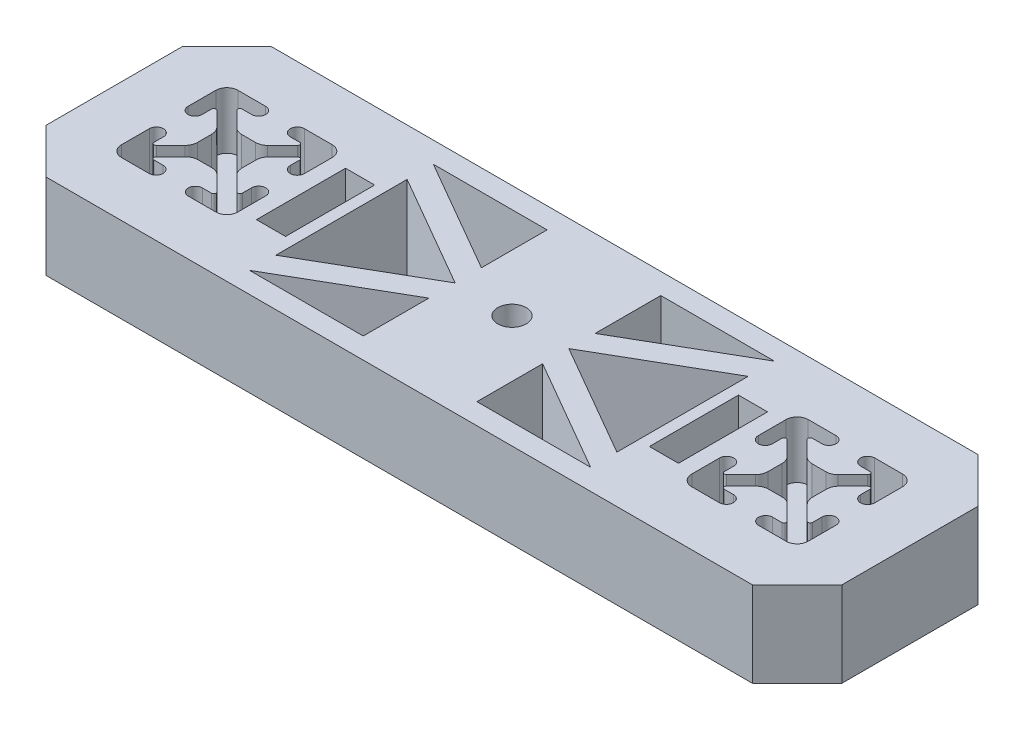
from build123d import *

# Parameters (mm, degrees)
SKETCH1_W           = 177.8
SKETCH1_H           = 50.4000008
BOSS_EXTRUDE1_DEPTH = 6.35
SKETCH2_W           = 177.8
SKETCH2_H           = 50.4000008
BOSS_EXTRUDE2_DEPTH = 12.7
SKETCH3_R           = 3.175
CUT_EXTRUDE1_DEPTH  = 186.784559586
CUT_EXTRUDE2_DEPTH  = 186.784559586
CHAMFER1_SIZE       = 10
SKETCH5_W           = 6.5
SKETCH5_H           = 19.9
CUT_EXTRUDE3_DEPTH  = 10.2
SKETCH6_W           = 6.5
SKETCH6_H           = 4.572
CUT_EXTRUDE4_DEPTH  = 186.086574555


with BuildPart() as part:
    # Sketch1 → Boss-Extrude1 (new body)
    with BuildSketch(Plane(origin=(0, 0, 0), x_dir=(1, 0, 0), z_dir=(0, 1, 0))):
        with Locations((88.9, 25.2000004)):
            Rectangle(SKETCH1_W, SKETCH1_H)
    extrude(amount=BOSS_EXTRUDE1_DEPTH)

    # Sketch2 → Boss-Extrude2 (add)
    with BuildSketch(Plane(origin=(0, 6.35, 0), x_dir=(1, 0, 0), z_dir=(0, 1, 0))):
        with Locations((88.9, 25.2000004)):
            Rectangle(SKETCH2_W, SKETCH2_H)
        with BuildLine():
            Line((38.207602115, 29.52001185), (38.207602115, 35.7371571))
            ThreePointArc((38.207602115, 35.7371571), (37.48390875, 37.484307436), (35.736758415, 38.2080008))
            Line((35.736758415, 38.2080008), (29.519613165, 38.2080008))
            ThreePointArc((29.519613165, 38.2080008), (27.941613165, 36.6300008), (29.519613165, 35.0520008))
            Line((29.519613165, 35.0520008), (31.618952135, 35.0520008))
            ThreePointArc((31.618952135, 35.0520008), (32.082805957, 34.741944038), (31.973665066, 34.194784253))
            Line((31.973665066, 34.194784253), (28.637609194, 30.863479703))
            ThreePointArc((28.637609194, 30.863479703), (27.774459736, 30.287408726), (26.756632806, 30.085138862))
            Line((26.756632806, 30.085138862), (23.642969309, 30.085138862))
            ThreePointArc((23.642969309, 30.085138862), (22.625142379, 30.287408726), (21.761992921, 30.863479703))
            Line((21.761992921, 30.863479703), (18.425937049, 34.194784253))
            ThreePointArc((18.425937049, 34.194784253), (18.316796158, 34.741944038), (18.78064998, 35.0520008))
            Line((18.78064998, 35.0520008), (20.87998895, 35.0520008))
            ThreePointArc((20.87998895, 35.0520008), (22.45798895, 36.6300008), (20.87998895, 38.2080008))
            Line((20.87998895, 38.2080008), (14.6628437, 38.2080008))
            ThreePointArc((14.6628437, 38.2080008), (12.915693364, 37.484307436), (12.192, 35.7371571))
            Line((12.192, 35.7371571), (12.192, 29.52001185))
            ThreePointArc((12.192, 29.52001185), (13.77, 27.94201185), (15.348, 29.52001185))
            Line((15.348, 29.52001185), (15.348, 31.596493464))
            ThreePointArc((15.348, 31.596493464), (15.657726258, 32.060210386), (16.204710632, 31.95171231))
            Line((16.204710632, 31.95171231), (19.406929995, 28.754053655))
            ThreePointArc((19.406929995, 28.754053655), (20.019806023, 27.837880259), (20.235040084, 26.756832148))
            Line((20.235040084, 26.756832148), (20.235040084, 23.643168652))
            ThreePointArc((20.235040084, 23.643168652), (20.019806023, 22.562120541), (19.406929995, 21.645947145))
            Line((19.406929995, 21.645947145), (16.204710632, 18.44828849))
            ThreePointArc((16.204710632, 18.44828849), (15.657726258, 18.339790414), (15.348, 18.803507336))
            Line((15.348, 18.803507336), (15.348, 20.87998895))
            ThreePointArc((15.348, 20.87998895), (13.77, 22.45798895), (12.192, 20.87998895))
            Line((12.192, 20.87998895), (12.192, 14.6628437))
            ThreePointArc((12.192, 14.6628437), (12.915693364, 12.915693364), (14.6628437, 12.192))
            Line((14.6628437, 12.192), (20.812064149, 12.192))
            ThreePointArc((20.812064149, 12.192), (22.390064149, 13.77), (20.812064149, 15.348))
            Line((20.812064149, 15.348), (18.78064998, 15.348))
            ThreePointArc((18.78064998, 15.348), (18.316796158, 15.658056762), (18.425937049, 16.205216547))
            Line((18.425937049, 16.205216547), (21.761992921, 19.536521097))
            ThreePointArc((21.761992921, 19.536521097), (22.625142379, 20.112592074), (23.642969309, 20.314861938))
            Line((23.642969309, 20.314861938), (26.756632806, 20.314861938))
            ThreePointArc((26.756632806, 20.314861938), (27.774459736, 20.112592074), (28.637609194, 19.536521097))
            Line((28.637609194, 19.536521097), (31.973665066, 16.205216547))
            ThreePointArc((31.973665066, 16.205216547), (32.082805957, 15.658056762), (31.618952135, 15.348))
            Line((31.618952135, 15.348), (29.587537966, 15.348))
            ThreePointArc((29.587537966, 15.348), (28.009537966, 13.77), (29.587537966, 12.192))
            Line((29.587537966, 12.192), (35.736758415, 12.192))
            ThreePointArc((35.736758415, 12.192), (37.48390875, 12.915693364), (38.207602115, 14.6628437))
            Line((38.207602115, 14.6628437), (38.207602115, 20.87998895))
            ThreePointArc((38.207602115, 20.87998895), (36.629602115, 22.45798895), (35.051602115, 20.87998895))
            Line((35.051602115, 20.87998895), (35.051602115, 18.803507336))
            ThreePointArc((35.051602115, 18.803507336), (34.741875857, 18.339790414), (34.194891482, 18.44828849))
            Line((34.194891482, 18.44828849), (30.99267212, 21.645947145))
            ThreePointArc((30.99267212, 21.645947145), (30.379796092, 22.562120541), (30.16456203, 23.643168652))
            Line((30.16456203, 23.643168652), (30.16456203, 26.756832148))
            ThreePointArc((30.16456203, 26.756832148), (30.379796092, 27.837880259), (30.99267212, 28.754053655))
            Line((30.99267212, 28.754053655), (34.194891482, 31.95171231))
            ThreePointArc((34.194891482, 31.95171231), (34.741875857, 32.060210386), (35.051602115, 31.596493464))
            Line((35.051602115, 31.596493464), (35.051602115, 29.52001185))
            ThreePointArc((35.051602115, 29.52001185), (36.629602115, 27.94201185), (38.207602115, 29.52001185))
        make_face(mode=Mode.SUBTRACT)
        with BuildLine():
            Line((142.748397885, 31.596493464), (142.748397885, 29.52001185))
            ThreePointArc((142.748397885, 29.52001185), (141.170397885, 27.94201185), (139.592397885, 29.52001185))
            Line((139.592397885, 29.52001185), (139.592397885, 35.7371571))
            ThreePointArc((139.592397885, 35.7371571), (140.31609125, 37.484307436), (142.063241585, 38.2080008))
            Line((142.063241585, 38.2080008), (148.280386835, 38.2080008))
            ThreePointArc((148.280386835, 38.2080008), (149.858386835, 36.6300008), (148.280386835, 35.0520008))
            Line((148.280386835, 35.0520008), (146.181047865, 35.0520008))
            ThreePointArc((146.181047865, 35.0520008), (145.717194043, 34.741944038), (145.826334934, 34.194784253))
            Line((145.826334934, 34.194784253), (149.162390806, 30.863479703))
            ThreePointArc((149.162390806, 30.863479703), (150.025540264, 30.287408726), (151.043367194, 30.085138862))
            Line((151.043367194, 30.085138862), (154.157030691, 30.085138862))
            ThreePointArc((154.157030691, 30.085138862), (155.174857621, 30.287408726), (156.038007079, 30.863479703))
            Line((156.038007079, 30.863479703), (159.374062951, 34.194784253))
            ThreePointArc((159.374062951, 34.194784253), (159.483203842, 34.741944038), (159.01935002, 35.0520008))
            Line((159.01935002, 35.0520008), (156.92001105, 35.0520008))
            ThreePointArc((156.92001105, 35.0520008), (155.34201105, 36.6300008), (156.92001105, 38.2080008))
            Line((156.92001105, 38.2080008), (163.1371563, 38.2080008))
            ThreePointArc((163.1371563, 38.2080008), (164.884306636, 37.484307436), (165.608, 35.7371571))
            Line((165.608, 35.7371571), (165.608, 29.52001185))
            ThreePointArc((165.608, 29.52001185), (164.03, 27.94201185), (162.452, 29.52001185))
            Line((162.452, 29.52001185), (162.452, 31.596493464))
            ThreePointArc((162.452, 31.596493464), (162.142273742, 32.060210386), (161.595289368, 31.95171231))
            Line((161.595289368, 31.95171231), (158.393070005, 28.754053655))
            ThreePointArc((158.393070005, 28.754053655), (157.780193977, 27.837880259), (157.564959916, 26.756832148))
            Line((157.564959916, 26.756832148), (157.564959916, 23.643168652))
            ThreePointArc((157.564959916, 23.643168652), (157.780193977, 22.562120541), (158.393070005, 21.645947145))
            Line((158.393070005, 21.645947145), (161.595289368, 18.44828849))
            ThreePointArc((161.595289368, 18.44828849), (162.142273742, 18.339790414), (162.452, 18.803507336))
            Line((162.452, 18.803507336), (162.452, 20.87998895))
            ThreePointArc((162.452, 20.87998895), (164.03, 22.45798895), (165.608, 20.87998895))
            Line((165.608, 20.87998895), (165.608, 14.6628437))
            ThreePointArc((165.608, 14.6628437), (164.884306636, 12.915693364), (163.1371563, 12.192))
            Line((163.1371563, 12.192), (156.987935851, 12.192))
            ThreePointArc((156.987935851, 12.192), (155.409935851, 13.77), (156.987935851, 15.348))
            Line((156.987935851, 15.348), (159.01935002, 15.348))
            ThreePointArc((159.01935002, 15.348), (159.483203842, 15.658056762), (159.374062951, 16.205216547))
            Line((159.374062951, 16.205216547), (156.038007079, 19.536521097))
            ThreePointArc((156.038007079, 19.536521097), (155.174857621, 20.112592074), (154.157030691, 20.314861938))
            Line((154.157030691, 20.314861938), (151.043367194, 20.314861938))
            ThreePointArc((151.043367194, 20.314861938), (150.025540264, 20.112592074), (149.162390806, 19.536521097))
            Line((149.162390806, 19.536521097), (145.826334934, 16.205216547))
            ThreePointArc((145.826334934, 16.205216547), (145.717194043, 15.658056762), (146.181047865, 15.348))
            Line((146.181047865, 15.348), (148.212462034, 15.348))
            ThreePointArc((148.212462034, 15.348), (149.790462034, 13.77), (148.212462034, 12.192))
            Line((148.212462034, 12.192), (142.063241585, 12.192))
            ThreePointArc((142.063241585, 12.192), (140.31609125, 12.915693364), (139.592397885, 14.6628437))
            Line((139.592397885, 14.6628437), (139.592397885, 20.87998895))
            ThreePointArc((139.592397885, 20.87998895), (141.170397885, 22.45798895), (142.748397885, 20.87998895))
            Line((142.748397885, 20.87998895), (142.748397885, 18.803507336))
            ThreePointArc((142.748397885, 18.803507336), (143.058124143, 18.339790414), (143.605108518, 18.44828849))
            Line((143.605108518, 18.44828849), (146.80732788, 21.645947145))
            ThreePointArc((146.80732788, 21.645947145), (147.420203908, 22.562120541), (147.63543797, 23.643168652))
            Line((147.63543797, 23.643168652), (147.63543797, 26.756832148))
            ThreePointArc((147.63543797, 26.756832148), (147.420203908, 27.837880259), (146.80732788, 28.754053655))
            Line((146.80732788, 28.754053655), (143.605108518, 31.95171231))
            ThreePointArc((143.605108518, 31.95171231), (143.058124143, 32.060210386), (142.748397885, 31.596493464))
        make_face(mode=Mode.SUBTRACT)
    extrude(amount=BOSS_EXTRUDE2_DEPTH)

    # Sketch3 → Cut-Extrude1 (cut, through all)
    with BuildSketch(Plane(origin=(0, 19.05, 0), x_dir=(1, 0, 0), z_dir=(0, 1, 0))):
        with Locations((88.9, 25.2000004)):
            Circle(SKETCH3_R)
    extrude(amount=-CUT_EXTRUDE1_DEPTH, mode=Mode.SUBTRACT)

    # Sketch4 → Cut-Extrude2 (cut, through all)
    with BuildSketch(Plane(origin=(0, 19.05, 0), x_dir=(1, 0, 0), z_dir=(0, 1, 0))):
        Polygon((50.8, 45.730575972), (76.2, 45.730575972), (76.2, 31.065879135), align=None)
        Polygon((76.2, 19.334121665), (76.2, 4.669424828), (50.8, 4.669424828), align=None)
        Polygon((50.8, 39.864697237), (50.8, 10.535303563), (76.2, 25.2000004), align=None)
        Polygon((101.6, 25.2000004), (127, 39.864697237), (127, 10.535303563), align=None)
        Polygon((127, 4.669424828), (101.6, 19.334121665), (101.6, 4.669424828), align=None)
        Polygon((101.6, 31.065879135), (127, 45.730575972), (101.6, 45.730575972), align=None)
    extrude(amount=-CUT_EXTRUDE2_DEPTH, mode=Mode.SUBTRACT)

    # Chamfer1
    chamfer1_edges = [part.edges().sort_by_distance(p)[0] for p in [
        (177.8, 9.525, -50.4000008),
        (177.8, 9.525, 0),
        (0, 9.525, 0),
        (0, 9.525, -50.4000008),
    ]]
    chamfer(chamfer1_edges, length=CHAMFER1_SIZE)

    # Sketch5 → Cut-Extrude3 (cut)
    with BuildSketch(Plane(origin=(0, 19.05, 0), x_dir=(1, 0, 0), z_dir=(0, 1, 0))):
        with Locations((45.013602115, 25.2000004)):
            Rectangle(SKETCH5_W, SKETCH5_H)
    cut_extrude3 = extrude(amount=-CUT_EXTRUDE3_DEPTH, mode=Mode.SUBTRACT)

    # Sketch6 → Cut-Extrude4 (cut, through all)
    with BuildSketch(Plane(origin=(0, 8.85, 0), x_dir=(1, 0, 0), z_dir=(0, 1, 0))):
        with Locations((45.013602115, 32.8640004)):
            Rectangle(SKETCH6_W, SKETCH6_H)
        with Locations((45.013602115, 25.2000004)):
            Rectangle(SKETCH6_W, SKETCH6_H)
        with Locations((45.013602115, 17.5360004)):
            Rectangle(SKETCH6_W, SKETCH6_H)
    cut_extrude4 = extrude(amount=-CUT_EXTRUDE4_DEPTH, mode=Mode.SUBTRACT)

    # Mirror1: Cut-Extrude3, Cut-Extrude4 across plane
    add(cut_extrude3.mirror(Plane.ZY.offset(-88.9)), mode=Mode.SUBTRACT)
    add(cut_extrude4.mirror(Plane.ZY.offset(-88.9)), mode=Mode.SUBTRACT)


solid = part.part
